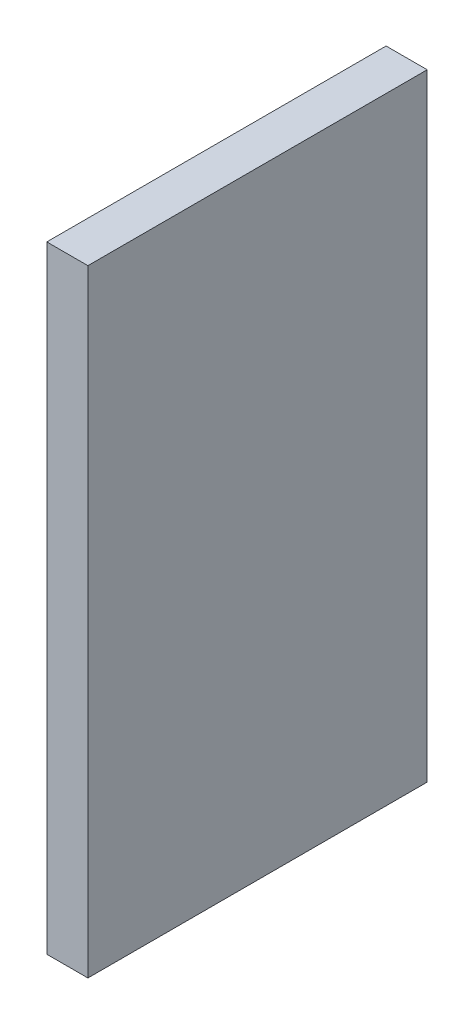
from build123d import *

# Parameters (mm, degrees)
SKETCH1_W           = 4
SKETCH1_H           = 33
BOSS_EXTRUDE1_DEPTH = 60


with BuildPart() as part:
    # Sketch1 → Boss-Extrude1 (new body)
    with BuildSketch(Plane(origin=(0, 0, 0), x_dir=(1, 0, 0), z_dir=(0, 1, 0))):
        with Locations((2, 16.5)):
            Rectangle(SKETCH1_W, SKETCH1_H)
    extrude(amount=BOSS_EXTRUDE1_DEPTH)


solid = part.part
